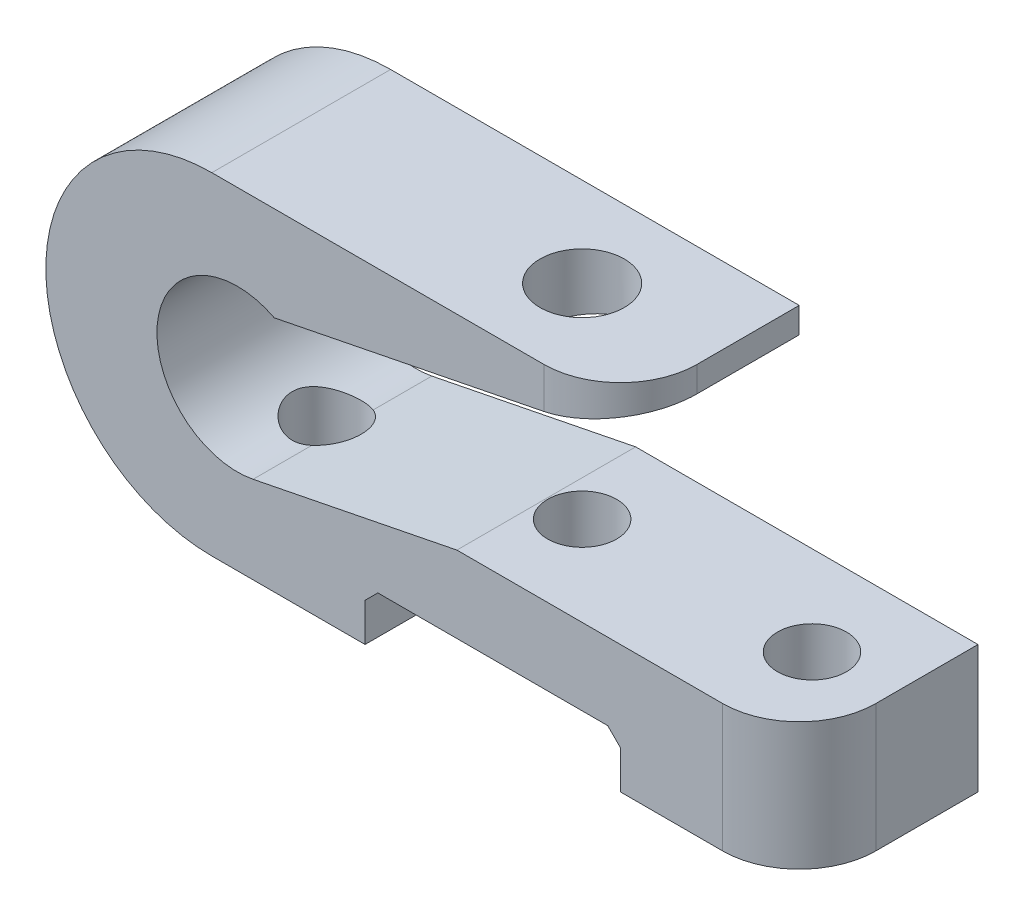
from build123d import *

# Parameters (mm, degrees)
BOSS_EXTRUDE1_DEPTH = 7
CUT_EXTRUDE1_REACH  = 28.495
SKETCH2_R           = 1.35
CUT_EXTRUDE2_REACH  = 28.495
SKETCH3_R           = 1.65
FILLET1_R           = 3
CHAMFER2_SIZE       = 0.5


with BuildPart() as part:
    # Sketch1 → Boss-Extrude1 (new body)
    with BuildSketch(Plane.XY):
        with BuildLine():
            Line((1.443086969, 2.8), (15, 5.5))
            Line((15, 5.5), (15, 6.5))
            Line((15, 6.5), (-1, 6.5))
            ThreePointArc((-1, 6.5), (-7.5, 0), (-1, -6.5))
            Line((-1, -6.5), (5, -6.5))
            Line((5, -6.5), (5, -4.5))
            Line((5, -4.5), (15, -4.5))
            Line((15, -4.5), (15, -6.5))
            Line((15, -6.5), (22, -6.5))
            Line((22, -6.5), (22, -1.5))
            Line((22, -1.5), (8.595407496, -1.5))
            Line((8.595407496, -1.5), (0.615271538, -3.089326939))
            ThreePointArc((0.615271538, -3.089326939), (-3.119335327, 0.438459937), (1.443086969, 2.8))
        make_face()
    extrude(amount=BOSS_EXTRUDE1_DEPTH)

    # Sketch2 → Cut-Extrude1 (cut, up to next)
    with BuildSketch(Plane.XZ.offset(6.5), mode=Mode.PRIVATE) as cut_extrude1_sk1:
        with Locations((0, 3.5)):
            Circle(SKETCH2_R)
    cut_extrude1_tool1 = extrude(cut_extrude1_sk1.sketch, amount=-CUT_EXTRUDE1_REACH, mode=Mode.PRIVATE) & part.part
    # Sketch2 → Cut-Extrude1 (cut, up to next)
    with BuildSketch(Plane.XZ.offset(6.5), mode=Mode.PRIVATE) as cut_extrude1_sk2:
        with Locations((10, 3.5)):
            Circle(SKETCH2_R)
    cut_extrude1_tool2 = extrude(cut_extrude1_sk2.sketch, amount=-CUT_EXTRUDE1_REACH, mode=Mode.PRIVATE) & part.part
    # Sketch2 → Cut-Extrude1 (cut, up to next)
    with BuildSketch(Plane.XZ.offset(6.5), mode=Mode.PRIVATE) as cut_extrude1_sk3:
        with Locations((19, 3.5)):
            Circle(SKETCH2_R)
    cut_extrude1_tool3 = extrude(cut_extrude1_sk3.sketch, amount=-CUT_EXTRUDE1_REACH, mode=Mode.PRIVATE) & part.part
    add(cut_extrude1_tool1.solids().sort_by_distance((0, -6.5, 3.5))[0], mode=Mode.SUBTRACT)
    add(cut_extrude1_tool2.solids().sort_by_distance((10, -6.5, 3.5))[0], mode=Mode.SUBTRACT)
    add(cut_extrude1_tool3.solids().sort_by_distance((19, -6.5, 3.5))[0], mode=Mode.SUBTRACT)

    # Sketch3 → Cut-Extrude2 (cut, up to next)
    with BuildSketch(Plane(origin=(0, 6.5, 0), x_dir=(1, 0, 0), z_dir=(0, 1, 0)), mode=Mode.PRIVATE) as cut_extrude2_sk1:
        with Locations((10, -3.5)):
            Circle(SKETCH3_R)
    cut_extrude2_tool1 = extrude(cut_extrude2_sk1.sketch, amount=-CUT_EXTRUDE2_REACH, mode=Mode.PRIVATE) & part.part
    add(cut_extrude2_tool1.solids().sort_by_distance((10, 6.5, 3.5))[0], mode=Mode.SUBTRACT)

    # Fillet1
    fillet1_edges = [part.edges().sort_by_distance(p)[0] for p in [
        (15, 6, 7),
        (22, -4, 7),
    ]]
    fillet(fillet1_edges, radius=FILLET1_R)

    # Chamfer2
    chamfer2_edges = [part.edges().sort_by_distance(p)[0] for p in [
        (15, -4.5, 3.5),
        (5, -4.5, 3.5),
    ]]
    chamfer(chamfer2_edges, length=CHAMFER2_SIZE)


solid = part.part
